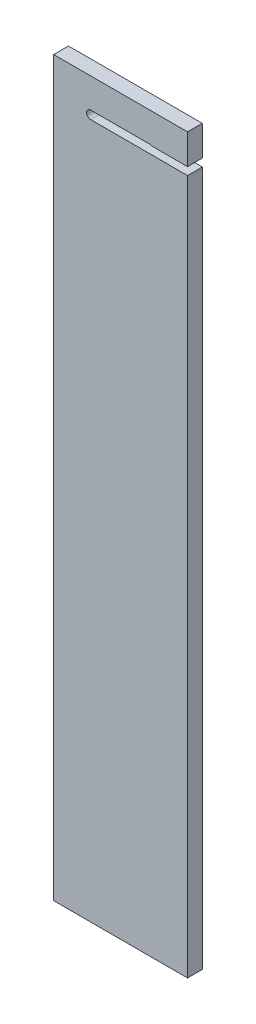
from build123d import *

# Parameters (mm, degrees)
BOSS_EXTRUDE1_DEPTH = 6.35
FILLET1_R           = 3.175


with BuildPart() as part:
    # Sketch1 → Boss-Extrude1 (new body)
    with BuildSketch(Plane.XY):
        with BuildLine():
            Line((-28.75, 165.481), (-28.75, 149.225))
            Line((-28.75, 149.225), (-12.827, 149.225))
            ThreePointArc((-12.827, 149.225), (-14.605, 151.003), (-12.827, 152.781))
            Line((-12.827, 152.781), (12.827, 152.781))
            Line((12.827, 152.781), (12.827, 152.527))
            Line((12.827, 152.527), (28.75, 152.527))
            Line((28.75, 152.527), (28.75, 165.481))
            Line((28.75, 165.481), (-28.75, 165.481))
        make_face()
        Polygon((-12.827, 149.225), (-28.75, 149.225), (-28.75, -149.225), (28.75, -149.225), (28.75, 149.225), align=None)
    extrude(amount=BOSS_EXTRUDE1_DEPTH)

    # Fillet1
    # the kernel refuses this fillet: 3.175 mm, written as the material it takes off along each edge
    with BuildSketch(Plane(origin=(12.827, 152.527, -3.110851973), x_dir=(1, 0, 0), z_dir=(0, 0, 1))) as fillet1_piece_1:
        with BuildLine():
            CenterArc((1.244340789, 3.175), FILLET1_R, 246.926081934, 23.073918066)
            Line((0, 0.254), (-0.024886816, 0.19558))
            ThreePointArc((-0.024886816, 0.19558), (-0.0635, 0.127), (-0.0635, 0))
            Line((-0.0635, 0), (0, -0.0635))
            Line((0, -0.0635), (1.244340789, -0.0635))
            Line((1.244340789, -0.0635), (1.244340789, 0))
        make_face()
    extrude(amount=12.571703947, mode=Mode.SUBTRACT)


solid = part.part
